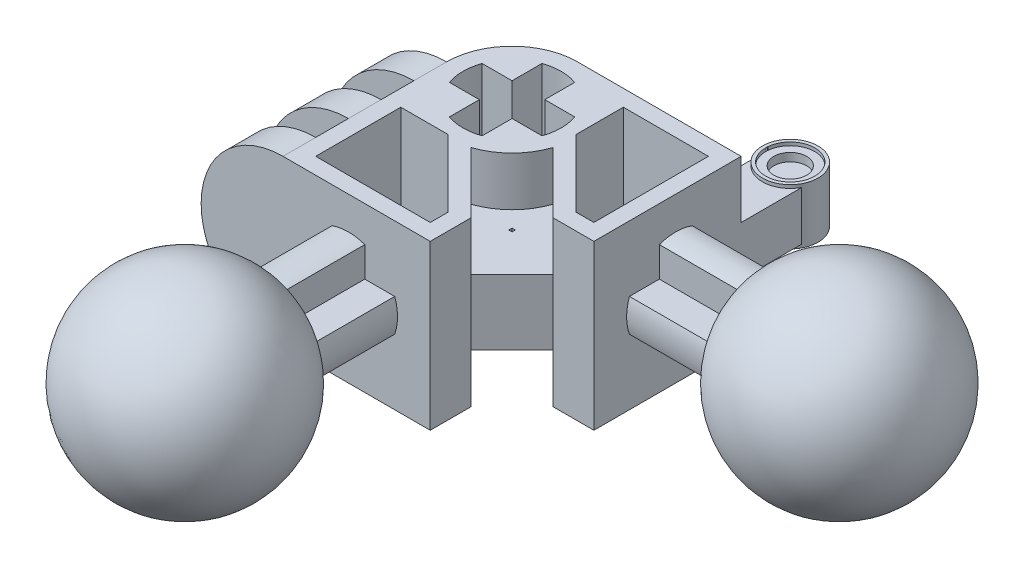
from build123d import *

# Parameters (mm, degrees)
SKETCH3_W                = 1
SKETCH3_H                = 1
BOSS_EXTRUDE1_DEPTH      = 10
SKETCH4_W                = 1
SKETCH4_H                = 1
BOSS_EXTRUDE2_DEPTH      = 10
BOSS_EXTRUDE3_DEPTH      = 2.5
BOSS_EXTRUDE3_DEPTH_BACK = 2.5
SKETCH7_W                = 7
SKETCH7_H                = 7
CUT_EXTRUDE2_DEPTH       = 5
CUT_EXTRUDE3_DEPTH       = 1.5
SKETCH10_W               = 0.1
SKETCH10_H               = 0.1
CUT_EXTRUDE4_DEPTH       = 5
CUT_EXTRUDE5_DEPTH       = 5
CUT_EXTRUDE6_START       = -1.5
SKETCH10_3_W             = 0.1
SKETCH10_3_H             = 0.1
CUT_EXTRUDE6_DEPTH       = 1.5
SKETCH11_W               = 1
SKETCH11_H               = 2.5
REVOLVE7_ANGLE           = 180
SKETCH12_W               = 1.5
SKETCH12_H               = 0.75
BOSS_EXTRUDE4_DEPTH      = 3
CUT_EXTRUDE7_DEPTH       = 3
SKETCH14_R               = 0.5
CUT_EXTRUDE8_DEPTH       = 0.25
BOSS_EXTRUDE5_START      = -0.75
BOSS_EXTRUDE5_OUTLINE_R  = 0.85
BOSS_EXTRUDE5_DEPTH      = 0.85
CUT_EXTRUDE9_DEPTH       = 5
REVOLVE8_START           = 1.588848657
REVOLVE8_OUTLINE_R       = 0.5
REVOLVE8_DEPTH           = 3.673765089
REVOLVE8_2_OUTLINE_R     = 0.65
REVOLVE8_2_OUTLINE_R_2   = 0.5
REVOLVE8_2_DEPTH         = 1.950034347


# Read off the part's stored shape, not the designer's step: Boss-Extrude5, Revolve8
with BuildPart() as part:
    # Sketch3 → Boss-Extrude1 (new body)
    with BuildSketch(Plane(origin=(0, 0, 0), x_dir=(0, 0, -1), z_dir=(1, 0, 0))):
        with BuildLine():
            Line((-0.5, 1.414213562), (-0.5, 0.5))
            Line((-0.5, 0.5), (0.5, 0.5))
            Line((0.5, 0.5), (0.5, 1.414213562))
            ThreePointArc((0.5, 1.414213562), (0.253652968, 1.478397839), (0, 1.5))
            ThreePointArc((0, 1.5), (-0.253652968, 1.478397839), (-0.5, 1.414213562))
        make_face()
        Rectangle(SKETCH3_W, SKETCH3_H)
        with BuildLine():
            Line((0.5, 0.5), (0.5, -0.5))
            Line((0.5, -0.5), (1.414213562, -0.5))
            ThreePointArc((1.414213562, -0.5), (1.478397839, -0.253652968), (1.5, 0))
            ThreePointArc((1.5, 0), (1.478397839, 0.253652968), (1.414213562, 0.5))
            Line((1.414213562, 0.5), (0.5, 0.5))
        make_face()
        with BuildLine():
            Line((-1.414213562, -0.5), (-0.5, -0.5))
            Line((-0.5, -0.5), (-0.5, 0.5))
            Line((-0.5, 0.5), (-1.414213562, 0.5))
            ThreePointArc((-1.414213562, 0.5), (-1.478397839, 0.253652968), (-1.5, 0))
            ThreePointArc((-1.5, 0), (-1.478397839, -0.253652968), (-1.414213562, -0.5))
        make_face()
        with BuildLine():
            ThreePointArc((-0.5, -1.414213562), (-0.253652968, -1.478397839), (0, -1.5))
            ThreePointArc((0, -1.5), (0.253652968, -1.478397839), (0.5, -1.414213562))
            Line((0.5, -1.414213562), (0.5, -0.5))
            Line((0.5, -0.5), (-0.5, -0.5))
            Line((-0.5, -0.5), (-0.5, -1.414213562))
        make_face()
    extrude(amount=BOSS_EXTRUDE1_DEPTH)

    # Sketch4 → Boss-Extrude2 (add)
    with BuildSketch(Plane.XY):
        with BuildLine():
            Line((-0.5, 1.414213562), (-0.5, 0.5))
            Line((-0.5, 0.5), (0.5, 0.5))
            Line((0.5, 0.5), (0.5, 1.414213562))
            ThreePointArc((0.5, 1.414213562), (0.253652968, 1.478397839), (0, 1.5))
            ThreePointArc((0, 1.5), (-0.253652968, 1.478397839), (-0.5, 1.414213562))
        make_face()
        Rectangle(SKETCH4_W, SKETCH4_H)
        with BuildLine():
            ThreePointArc((-1.5, 0), (-1.478397839, -0.253652968), (-1.414213562, -0.5))
            Line((-1.414213562, -0.5), (-0.5, -0.5))
            Line((-0.5, -0.5), (-0.5, 0.5))
            Line((-0.5, 0.5), (-1.414213562, 0.5))
            ThreePointArc((-1.414213562, 0.5), (-1.478397839, 0.253652968), (-1.5, 0))
        make_face()
        with BuildLine():
            Line((0.5, 0.5), (0.5, -0.5))
            Line((0.5, -0.5), (1.414213562, -0.5))
            ThreePointArc((1.414213562, -0.5), (1.478397839, -0.253652968), (1.5, 0))
            ThreePointArc((1.5, 0), (1.478397839, 0.253652968), (1.414213562, 0.5))
            Line((1.414213562, 0.5), (0.5, 0.5))
        make_face()
        with BuildLine():
            Line((0.5, -0.5), (-0.5, -0.5))
            Line((-0.5, -0.5), (-0.5, -1.414213562))
            ThreePointArc((-0.5, -1.414213562), (-0.253652968, -1.478397839), (0, -1.5))
            ThreePointArc((0, -1.5), (0.253652968, -1.478397839), (0.5, -1.414213562))
            Line((0.5, -1.414213562), (0.5, -0.5))
        make_face()
    extrude(amount=BOSS_EXTRUDE2_DEPTH)

    # Sketch5 → Revolve5 (revolve)
    with BuildSketch(Plane(origin=(10, 0, 0), x_dir=(0, 0, -1), z_dir=(1, 0, 0)), mode=Mode.PRIVATE) as revolve5_sk:
        with BuildLine():
            ThreePointArc((3, 0), (2.121320344, 2.121320344), (0, 3))
            Line((0, 3), (0, 1.5))
            ThreePointArc((0, 1.5), (0.253652968, 1.478397839), (0.5, 1.414213562))
            Line((0.5, 1.414213562), (0.5, 0.5))
            Line((0.5, 0.5), (1.414213562, 0.5))
            ThreePointArc((1.414213562, 0.5), (1.5, 0), (1.414213562, -0.5))
            Line((1.414213562, -0.5), (0.5, -0.5))
            Line((0.5, -0.5), (0.5, -1.414213562))
            ThreePointArc((0.5, -1.414213562), (0.253652968, -1.478397839), (0, -1.5))
            Line((0, -1.5), (0, -3))
            ThreePointArc((0, -3), (2.121320344, -2.121320344), (3, 0))
        make_face()
        with BuildLine():
            ThreePointArc((0.5, 1.414213562), (0.253652968, 1.478397839), (0, 1.5))
            Line((0, 1.5), (0, -1.5))
            ThreePointArc((0, -1.5), (0.253652968, -1.478397839), (0.5, -1.414213562))
            Line((0.5, -1.414213562), (0.5, -0.5))
            Line((0.5, -0.5), (1.414213562, -0.5))
            ThreePointArc((1.414213562, -0.5), (1.5, 0), (1.414213562, 0.5))
            Line((1.414213562, 0.5), (0.5, 0.5))
            Line((0.5, 0.5), (0.5, 1.414213562))
        make_face()
    revolve(revolve5_sk.sketch.rotate(Axis((10, 3, 0), (0, -1, 0)), 120), axis=Axis((10, 3, 0), (0, -1, 0)))

    # Sketch6 → Revolve6 (revolve)
    with BuildSketch(Plane.XY.offset(10), mode=Mode.PRIVATE) as revolve6_sk:
        with BuildLine():
            ThreePointArc((3, 0), (2.121320344, 2.121320344), (0, 3))
            Line((0, 3), (0, 1.5))
            ThreePointArc((0, 1.5), (0.253652968, 1.478397839), (0.5, 1.414213562))
            Line((0.5, 1.414213562), (0.5, 0.5))
            Line((0.5, 0.5), (1.414213562, 0.5))
            ThreePointArc((1.414213562, 0.5), (1.5, 0), (1.414213562, -0.5))
            Line((1.414213562, -0.5), (0.5, -0.5))
            Line((0.5, -0.5), (0.5, -1.414213562))
            ThreePointArc((0.5, -1.414213562), (0.253652968, -1.478397839), (0, -1.5))
            Line((0, -1.5), (0, -3))
            ThreePointArc((0, -3), (2.121320344, -2.121320344), (3, 0))
        make_face()
        with BuildLine():
            ThreePointArc((0.5, 1.414213562), (0.253652968, 1.478397839), (0, 1.5))
            Line((0, 1.5), (0, -1.5))
            ThreePointArc((0, -1.5), (0.253652968, -1.478397839), (0.5, -1.414213562))
            Line((0.5, -1.414213562), (0.5, -0.5))
            Line((0.5, -0.5), (1.414213562, -0.5))
            ThreePointArc((1.414213562, -0.5), (1.5, 0), (1.414213562, 0.5))
            Line((1.414213562, 0.5), (0.5, 0.5))
            Line((0.5, 0.5), (0.5, 1.414213562))
        make_face()
    revolve(revolve6_sk.sketch.rotate(Axis((0, 3, 10), (0, -1, 0)), 120), axis=Axis((0, 3, 10), (0, -1, 0)))

    # Sketch7 → Boss-Extrude3 (add, two sides: drawn at the far end of the back side and taken through both)
    with BuildSketch(Plane(origin=(0, 0, 0), x_dir=(1, 0, 0), z_dir=(0, 1, 0)).offset(-BOSS_EXTRUDE3_DEPTH_BACK)):
        with Locations((1.5, -1.5)):
            Rectangle(SKETCH7_W, SKETCH7_H)
    extrude(amount=BOSS_EXTRUDE3_DEPTH + BOSS_EXTRUDE3_DEPTH_BACK)

    # Sketch8 → Cut-Extrude2 (cut)
    with BuildSketch(Plane(origin=(0, 2.5, 0), x_dir=(1, 0, 0), z_dir=(0, 1, 0))):
        with BuildLine():
            Line((-1.414213562, 1.414213562), (-2, 2))
            Line((-2, 2), (-2, 0))
            ThreePointArc((-2, 0), (-1.847759065, 0.765366865), (-1.414213562, 1.414213562))
        make_face()
        with BuildLine():
            Line((0, 2), (-2, 2))
            Line((-2, 2), (-1.414213562, 1.414213562))
            ThreePointArc((-1.414213562, 1.414213562), (-0.765366865, 1.847759065), (0, 2))
        make_face()
        with BuildLine():
            Line((-0.5, -0.5), (-0.5, 0.5))
            Line((-0.5, 0.5), (-1.414213562, 0.5))
            ThreePointArc((-1.414213562, 0.5), (-1.478397839, 0.253652968), (-1.5, 0))
            ThreePointArc((-1.5, 0), (-1.478397839, -0.253652968), (-1.414213562, -0.5))
            Line((-1.414213562, -0.5), (-0.5, -0.5))
        make_face()
        Polygon((0.5, 0.5), (-0.5, 0.5), (0.5, -0.5), align=None)
        Polygon((0.5, -0.5), (-0.5, 0.5), (-0.5, -0.5), align=None)
        with BuildLine():
            Line((0.5, -1.414213562), (0.5, -0.5))
            Line((0.5, -0.5), (-0.5, -0.5))
            Line((-0.5, -0.5), (-0.5, -1.414213562))
            ThreePointArc((-0.5, -1.414213562), (-0.253652968, -1.478397839), (0, -1.5))
            ThreePointArc((0, -1.5), (0.253652968, -1.478397839), (0.5, -1.414213562))
        make_face()
        with BuildLine():
            Line((-0.5, 1.414213562), (-0.5, 0.5))
            Line((-0.5, 0.5), (0.5, 0.5))
            Line((0.5, 0.5), (0.5, 1.414213562))
            ThreePointArc((0.5, 1.414213562), (0.253652968, 1.478397839), (0, 1.5))
            ThreePointArc((0, 1.5), (-0.253652968, 1.478397839), (-0.5, 1.414213562))
        make_face()
        with BuildLine():
            Line((0.5, 0.5), (0.5, -0.5))
            Line((0.5, -0.5), (1.414213562, -0.5))
            ThreePointArc((1.414213562, -0.5), (1.478397839, -0.253652968), (1.5, 0))
            ThreePointArc((1.5, 0), (1.478397839, 0.253652968), (1.414213562, 0.5))
            Line((1.414213562, 0.5), (0.5, 0.5))
        make_face()
    extrude(amount=-CUT_EXTRUDE2_DEPTH, mode=Mode.SUBTRACT)

    # Sketch9 → Cut-Extrude3 (cut)
    with BuildSketch(Plane(origin=(0, 2.5, 0), x_dir=(1, 0, 0), z_dir=(0, 1, 0))):
        with BuildLine():
            Line((3.75, -2.5), (1.893611446, -0.643611446))
            ThreePointArc((1.893611446, -0.643611446), (1.414213562, -1.414213562), (0.643611446, -1.893611446))
            Line((0.643611446, -1.893611446), (2.5, -3.75))
            Line((2.5, -3.75), (3.75, -2.5))
        make_face()
        Polygon((2, -4.5), (2, -3.957106781), (-0.057106781, -1.9), (-1.5, -1.9), (-1.5, -4.5), align=None)
        Polygon((3.957106781, -2), (4.5, -2), (4.5, 1.5), (1.9, 1.5), (1.9, 0.057106781), align=None)
    extrude(amount=-CUT_EXTRUDE3_DEPTH, mode=Mode.SUBTRACT)

    # Sketch10 → Cut-Extrude4 (cut)
    with BuildSketch(Plane(origin=(0, -2.5, 0), x_dir=(-1, 0, 0), z_dir=(0, -1, 0))):
        Polygon((-2, -3.957106781), (-2, -4.5), (1.5, -4.5), (1.5, -1.9), (0.057106781, -1.9), align=None)
        with Locations((-1.95, -1.95)):
            Rectangle(SKETCH10_W, SKETCH10_H)
        Polygon((-4.5, -2), (-3.957106781, -2), (-1.9, 0.057106781), (-1.9, 1.5), (-4.5, 1.5), align=None)
    extrude(amount=-CUT_EXTRUDE4_DEPTH, mode=Mode.SUBTRACT)

    # Sketch9<5> → Cut-Extrude5 (cut)
    with BuildSketch(Plane(origin=(0, 2.5, 0), x_dir=(1, 0, 0), z_dir=(0, 1, 0))):
        Polygon((3.125, -3.125), (2.5, -3.75), (2.5, -4.457106781), (3.478553391, -3.478553391), align=None)
        Polygon((3.75, -2.5), (3.125, -3.125), (3.478553391, -3.478553391), (4.457106781, -2.5), align=None)
        Polygon((3.478553391, -3.478553391), (2.5, -4.457106781), (2.5, -5), (5, -5), align=None)
        Polygon((4.457106781, -2.5), (3.478553391, -3.478553391), (5, -5), (5, -2.5), align=None)
    extrude(amount=-CUT_EXTRUDE5_DEPTH, mode=Mode.SUBTRACT)

    # Sketch10<3> → Cut-Extrude6 (cut)
    with BuildSketch(Plane(origin=(0, -2.5, 0), x_dir=(-1, 0, 0), z_dir=(0, -1, 0)).offset(CUT_EXTRUDE6_START)):
        Polygon((-3.25, -2), (-2, -2), (-2, -1.9), (-1.9, -1.9), (-1.9, -0.65), align=None)
        Polygon((-2.5, -2.5), (-2.5, -3.75), (-2, -3.25), (-2, -2), (-3.25, -2), (-3.75, -2.5), align=None)
        Polygon((-3.75, -2.5), (-3.125, -3.125), (-2.5, -2.5), align=None)
        Polygon((-3.125, -3.125), (-2.5, -3.75), (-2.5, -2.5), align=None)
        Polygon((-2, -2), (-2, -3.25), (-0.65, -1.9), (-1.9, -1.9), (-1.9, -2), align=None)
        with BuildLine():
            Line((-1.9, -1.9), (-0.65, -1.9))
            Line((-0.65, -1.9), (-0.643611446, -1.893611446))
            ThreePointArc((-0.643611446, -1.893611446), (-1.414213562, -1.414213562), (-1.893611446, -0.643611446))
            Line((-1.893611446, -0.643611446), (-1.9, -0.65))
            Line((-1.9, -0.65), (-1.9, -1.9))
        make_face()
        with Locations((-1.95, -1.95)):
            Rectangle(SKETCH10_3_W, SKETCH10_3_H)
    extrude(amount=CUT_EXTRUDE6_DEPTH, mode=Mode.SUBTRACT)

    # Sketch11 → Revolve7 (revolve)
    with BuildSketch(Plane.ZY.offset(2)):
        with Locations((0.5, 1.25)):
            Rectangle(SKETCH11_W, SKETCH11_H)
        with Locations((2.5, 1.25)):
            Rectangle(SKETCH11_W, SKETCH11_H)
        with Locations((4.5, 1.25)):
            Rectangle(SKETCH11_W, SKETCH11_H)
    revolve(axis=Axis((-2, 0, 0), (0, 0, 1)), revolution_arc=REVOLVE7_ANGLE)

    # Sketch12 → Boss-Extrude4 (add)
    with BuildSketch(Plane(origin=(0, 0, -2), x_dir=(-1, 0, 0), z_dir=(0, 0, -1))):
        with Locations((-4.25, 0.375)):
            Rectangle(SKETCH12_W, SKETCH12_H)
    boss_extrude4 = extrude(amount=BOSS_EXTRUDE4_DEPTH)

    # Sketch13 → Cut-Extrude7 (cut)
    with BuildSketch(Plane.XZ):
        with BuildLine():
            Line((3.502786405, -4.314589803), (3.5, -4.3125))
            Line((3.5, -4.3125), (3.5, -5))
            Line((3.5, -5), (4.25, -5))
            ThreePointArc((4.25, -5), (3.743019898, -4.802694469), (3.502786405, -4.314589803))
        make_face()
        with BuildLine():
            Line((5, -5), (5, -4.25))
            ThreePointArc((5, -4.25), (4.780330086, -4.780330086), (4.25, -5))
            Line((4.25, -5), (5, -5))
        make_face()
    extrude(amount=-CUT_EXTRUDE7_DEPTH, mode=Mode.SUBTRACT)

    # Sketch14 → Cut-Extrude8 (cut)
    with BuildSketch(Plane(origin=(0, 0.75, 0), x_dir=(1, 0, 0), z_dir=(0, 1, 0))):
        with Locations(Location((4.25, 4.25, 0), (0, 0, 180))):
            Circle(SKETCH14_R)
    cut_extrude8 = extrude(amount=-CUT_EXTRUDE8_DEPTH, mode=Mode.SUBTRACT)

    # Boss-Extrude5 outline → Boss-Extrude5 (add)
    with BuildSketch(Plane(origin=(0, 0.75, 0), x_dir=(1, 0, 0), z_dir=(0, 1, 0)).offset(BOSS_EXTRUDE5_START)):
        with Locations((4.25, 4.25)):
            Circle(BOSS_EXTRUDE5_OUTLINE_R)
        with BuildLine():
            ThreePointArc((3.502786405, 4.314589803), (4.999303074, 4.217675049), (3.5, 4.25))
            Line((3.5, 4.25), (3.5, 4.3125))
            Line((3.5, 4.3125), (3.502786405, 4.314589803))
        make_face(mode=Mode.SUBTRACT)
    boss_extrude5 = extrude(amount=BOSS_EXTRUDE5_DEPTH)

    # Mirror2: Boss-Extrude4, Cut-Extrude8, Boss-Extrude5 across plane
    add(boss_extrude4.mirror(Plane(origin=(0, 0, -5), x_dir=(0, 0, 1), z_dir=(0, 1, 0))))
    add(cut_extrude8.mirror(Plane(origin=(0, 0, -5), x_dir=(0, 0, 1), z_dir=(0, 1, 0))), mode=Mode.SUBTRACT)
    add(boss_extrude5.mirror(Plane(origin=(0, 0, -5), x_dir=(0, 0, 1), z_dir=(0, 1, 0))))

    # Sketch16 → Cut-Extrude9 (cut)
    with BuildSketch(Plane(origin=(0, -0.85, 0), x_dir=(-1, 0, 0), z_dir=(0, -1, 0))):
        with BuildLine():
            Line((-5.1, 5.1), (-5.1, 4.25))
            ThreePointArc((-5.1, 4.25), (-4.851040764, 4.851040764), (-4.25, 5.1))
            Line((-4.25, 5.1), (-5.1, 5.1))
        make_face()
        with BuildLine():
            Line((-3.4, 5.1), (-4.25, 5.1))
            ThreePointArc((-4.25, 5.1), (-3.648959236, 4.851040764), (-3.4, 4.25))
            Line((-3.4, 4.25), (-3.4, 5.1))
        make_face()
    extrude(amount=-CUT_EXTRUDE9_DEPTH, mode=Mode.SUBTRACT)

    # Revolve8 outline → Revolve8 (add)
    with BuildSketch(Plane(origin=(0, 0, 0), x_dir=(0.6, 0, 0.8000000000000002), z_dir=(0.8, 0, -0.6)).offset(REVOLVE8_START)):
        with Locations((-0.85, 0)):
            Circle(REVOLVE8_OUTLINE_R)
    extrude(amount=REVOLVE8_DEPTH)

    # Revolve8 2 outline → Revolve8 2 (add)
    with BuildSketch(Plane(origin=(0, 0, 0), x_dir=(0.6, 0, 0.8000000000000002), z_dir=(0.8, 0, -0.6)).offset(REVOLVE8_START)):
        with Locations((-0.85, 0)):
            Circle(REVOLVE8_2_OUTLINE_R)
        with Locations((-0.85, 0)):
            Circle(REVOLVE8_2_OUTLINE_R_2, mode=Mode.SUBTRACT)
    extrude(amount=REVOLVE8_2_DEPTH)


solid = part.part
